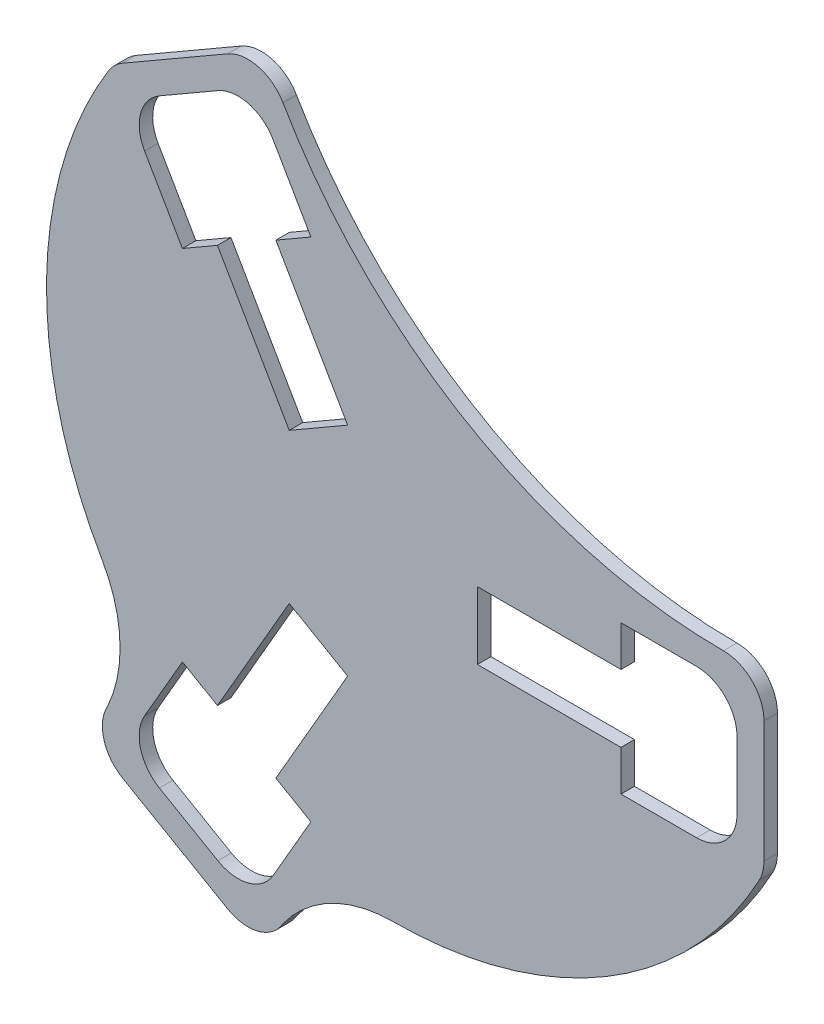
from build123d import *
from build123d.topology import SkipClean

# Parameters (mm, degrees)
BOSS_EXTRUDE1_DEPTH = 5
BOSS_EXTRUDE2_DEPTH = 5
SKETCH4_W           = 28
SKETCH4_H           = 55
CUT_EXTRUDE1_DEPTH  = 5
CIRPATTERN1_COUNT   = 3
SKETCH5_R           = 188.544827525
CUT_EXTRUDE2_DEPTH  = 5
BOSS_EXTRUDE3_START = -5
BOSS_EXTRUDE3_DEPTH = 5
BOSS_EXTRUDE4_START = -5
BOSS_EXTRUDE4_DEPTH = 5


with BuildPart() as part:
    # Sketch1 → Boss-Extrude1 (new body)
    with BuildSketch(Plane.XY):
        with BuildLine():
            Line((-8.818414939, -40.273942716), (-43.818414939, -100.895720981))
            ThreePointArc((-43.818414939, -100.895720981), (55, -95.262794416), (109.287464972, -12.5))
            Line((109.287464972, -12.5), (39.287464972, -12.5))
            Line((39.287464972, -12.5), (39.287464972, 12.5))
            Line((39.287464972, 12.5), (109.287464972, 12.5))
            ThreePointArc((109.287464972, 12.5), (55, 95.262794416), (-43.818414939, 100.895720981))
            Line((-43.818414939, 100.895720981), (-8.818414939, 40.273942716))
            Line((-8.818414939, 40.273942716), (-30.469050033, 27.773942716))
            Line((-30.469050033, 27.773942716), (-65.469050033, 88.395720981))
            ThreePointArc((-65.469050033, 88.395720981), (-110, 0), (-65.469050033, -88.395720981))
            Line((-65.469050033, -88.395720981), (-30.469050033, -27.773942716))
            Line((-30.469050033, -27.773942716), (-8.818414939, -40.273942716))
        make_face()
    extrude(amount=BOSS_EXTRUDE1_DEPTH)

    # Sketch3 → Boss-Extrude2 (add)
    with BuildSketch(Plane.XY.offset(5)):
        with BuildLine():
            Line((145.507042021, -22.5), (145.507042021, 22.5))
            ThreePointArc((145.507042021, 22.5), (141.113643739, 33.106601718), (130.507042021, 37.5))
            Line((130.507042021, 37.5), (96.507042021, 37.5))
            Line((96.507042021, 37.5), (96.507042021, -37.5))
            Line((96.507042021, -37.5), (130.507042021, -37.5))
            ThreePointArc((130.507042021, -37.5), (141.113643739, -33.106601718), (145.507042021, -22.5))
        make_face()
        with BuildLine():
            Line((120.507042021, -27.5), (106.507042021, -27.5))
            Line((106.507042021, -27.5), (106.507042021, 27.5))
            Line((106.507042021, 27.5), (120.507042021, 27.5))
            ThreePointArc((120.507042021, 27.5), (131.113643739, 23.106601718), (135.507042021, 12.5))
            Line((135.507042021, 12.5), (135.507042021, -12.5))
            ThreePointArc((135.507042021, -12.5), (131.113643739, -23.106601718), (120.507042021, -27.5))
        make_face(mode=Mode.SUBTRACT)
    boss_extrude2 = extrude(amount=-BOSS_EXTRUDE2_DEPTH)

    # Sketch4 → Cut-Extrude1 (cut)
    with BuildSketch(Plane.XY.offset(5)):
        with Locations((106.507042021, 0)):
            Rectangle(SKETCH4_W, SKETCH4_H)
    cut_extrude1 = extrude(amount=-CUT_EXTRUDE1_DEPTH, mode=Mode.SUBTRACT)

    # CirPattern1: Boss-Extrude2, Cut-Extrude1 ×3 about axis
    cirpattern1_axis = Axis((0, 0, 5), (0, 0, 1))
    add([boss_extrude2.rotate(cirpattern1_axis, i * 360 / CIRPATTERN1_COUNT) for i in range(1, CIRPATTERN1_COUNT)])
    add([cut_extrude1.rotate(cirpattern1_axis, i * 360 / CIRPATTERN1_COUNT) for i in range(1, CIRPATTERN1_COUNT)], mode=Mode.SUBTRACT)

    # Sketch5 → Cut-Extrude2 (cut)
    with BuildSketch(Plane.XY.offset(5)):
        with Locations((130.507042021, 226.044827525)):
            Circle(SKETCH5_R)
    extrude(amount=-CUT_EXTRUDE2_DEPTH, mode=Mode.SUBTRACT)

    # Sketch5<2> → Boss-Extrude3 (add)
    with SkipClean():  # the faces are left unmerged after this step: merging them gives an invalid solid
        with BuildSketch(Plane.XY.offset(5).offset(BOSS_EXTRUDE3_START)):
            with BuildLine():
                ThreePointArc((-17.04807225, 108.670894137), (-25.34145383, 119.929803482), (-32.777568368, 131.772413763))
                Line((-32.777568368, 131.772413763), (-19.229342058, 108.30619744))
                ThreePointArc((-19.229342058, 108.30619744), (-18.139623705, 108.494027724), (-17.04807225, 108.670894137))
            make_face()
            with BuildLine():
                Line((103.4105894, 37.5), (130.507042021, 37.5))
                ThreePointArc((130.507042021, 37.5), (116.532983402, 38.018558956), (102.6357911, 39.571383414))
                ThreePointArc((102.6357911, 39.571383414), (103.02839602, 38.537638919), (103.4105894, 37.5))
            make_face()
        extrude(amount=BOSS_EXTRUDE3_DEPTH)

    # Sketch6 → Boss-Extrude4 (add)
    with SkipClean():  # the faces are left unmerged after this step: merging them gives an invalid solid
        with BuildSketch(Plane.XY.offset(5).offset(BOSS_EXTRUDE4_START)):
            with BuildLine():
                ThreePointArc((-97.729473652, 94.272413763), (-99.737599555, 101.984047871), (-97.512688821, 109.635952372))
                ThreePointArc((-97.512688821, 109.635952372), (-120.427626352, 30.911934731), (-99.834826565, -48.451166975))
                ThreePointArc((-99.834826565, -48.451166975), (-93.217686534, -71.106119465), (-97.729473652, -94.272413763))
                Line((-97.729473652, -94.272413763), (-84.181247342, -70.80619744))
                ThreePointArc((-84.181247342, -70.80619744), (-110, 0), (-84.181247342, 70.80619744))
                Line((-84.181247342, 70.80619744), (-97.729473652, 94.272413763))
            make_face()
            with BuildLine():
                ThreePointArc((-32.777568368, -131.772413763), (-14.970864344, -116.281945279), (7.957467808, -110.68507948))
                ThreePointArc((7.957467808, -110.68507948), (86.984332686, -88.837417118), (143.703864867, -29.630488535))
                ThreePointArc((143.703864867, -29.630488535), (138.189576497, -35.383270703), (130.507042021, -37.5))
                Line((130.507042021, -37.5), (103.4105894, -37.5))
                ThreePointArc((103.4105894, -37.5), (55, -95.262794416), (-19.229342058, -108.30619744))
                Line((-19.229342058, -108.30619744), (-32.777568368, -131.772413763))
            make_face()
        extrude(amount=BOSS_EXTRUDE4_DEPTH)


solid = part.part
